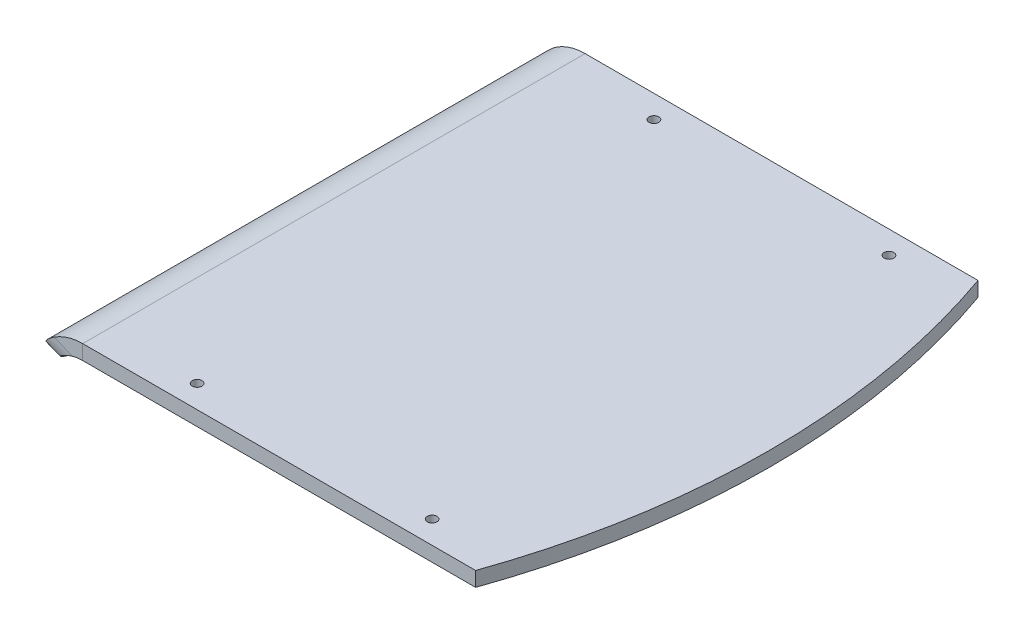
from build123d import *

# Parameters (mm, degrees)
SM_BASE_FLANGE_1_DEPTH = 171
SKETCH_5_OUTSIDE_W     = 426.43
SKETCH_5_OUTSIDE_H     = 439.1
SKETCH_5_OUTSIDE_R     = 515
CUT_EXTRUDE_2_DEPTH    = 250.150713085
FILLET_1_R             = 20
SKETCH_9_R             = 3.3
CUT_EXTRUDE_4_DEPTH    = 250.150713236


# Sheet-metal steps are written as plain solids
with BuildPart() as part:
    # Sketch 1 → Базовая кромка1 (new, symmetric)
    with BuildSketch(Plane.XY):
        with BuildLine():
            Line((150, 0), (-146.676192421, 0))
            ThreePointArc((-146.676192421, 0), (-160.818328044, -4.384471872), (-170, -16))
            Line((-170, -16), (-179.329523032, -12.4))
            ThreePointArc((-179.329523032, -12.4), (-166.475182294, 3.861739379), (-146.676192421, 10))
            Line((-146.676192421, 10), (150, 10))
            Line((150, 10), (150, 0))
        make_face()
    extrude(amount=SM_BASE_FLANGE_1_DEPTH, both=True)

    # Эскиз5 outside → Вырез-Вытянуть2 (cut, through all)
    with BuildSketch(Plane(origin=(0, 10, 0), x_dir=(1, 0, 0), z_dir=(0, 1, 0))):
        with Locations((-14.665, 0)):
            Rectangle(SKETCH_5_OUTSIDE_W, SKETCH_5_OUTSIDE_H)
        with Locations((-365, 0)):
            Circle(SKETCH_5_OUTSIDE_R, mode=Mode.SUBTRACT)
    extrude(amount=-CUT_EXTRUDE_2_DEPTH, mode=Mode.SUBTRACT)


with BuildPart() as cut_extrude_2_kept_piece:
    # of the separate pieces the step leaves, the one the design keeps (cut_extrude_2_pieces_kept)
    add(part.part.solids().sort_by_distance((-146.676192421, 10, -171))[0])

    # Скругление1
    fillet_1_edges = [cut_extrude_2_kept_piece.edges().sort_by_distance(p)[0] for p in [
        (-174.664761516, -14.2, -171),
        (-174.664761516, -14.2, 171),
    ]]
    fillet(fillet_1_edges, radius=FILLET_1_R)

    # Эскиз9 → Вырез-Вытянуть4 (cut, through all)
    with BuildSketch(Plane(origin=(0, 10, 0), x_dir=(1, 0, 0), z_dir=(0, 1, 0))):
        with Locations(Location((75.670476968, -155.5, 0), (0, 0, 180))):
            Circle(SKETCH_9_R)
        with Locations(Location((-84.329523032, -155.5, 0), (0, 0, 180))):
            Circle(SKETCH_9_R)
        with Locations((-84.329523032, 155.5)):
            Circle(SKETCH_9_R)
        with Locations((75.670476968, 155.5)):
            Circle(SKETCH_9_R)
    extrude(amount=-CUT_EXTRUDE_4_DEPTH, mode=Mode.SUBTRACT)


solid = cut_extrude_2_kept_piece.part
